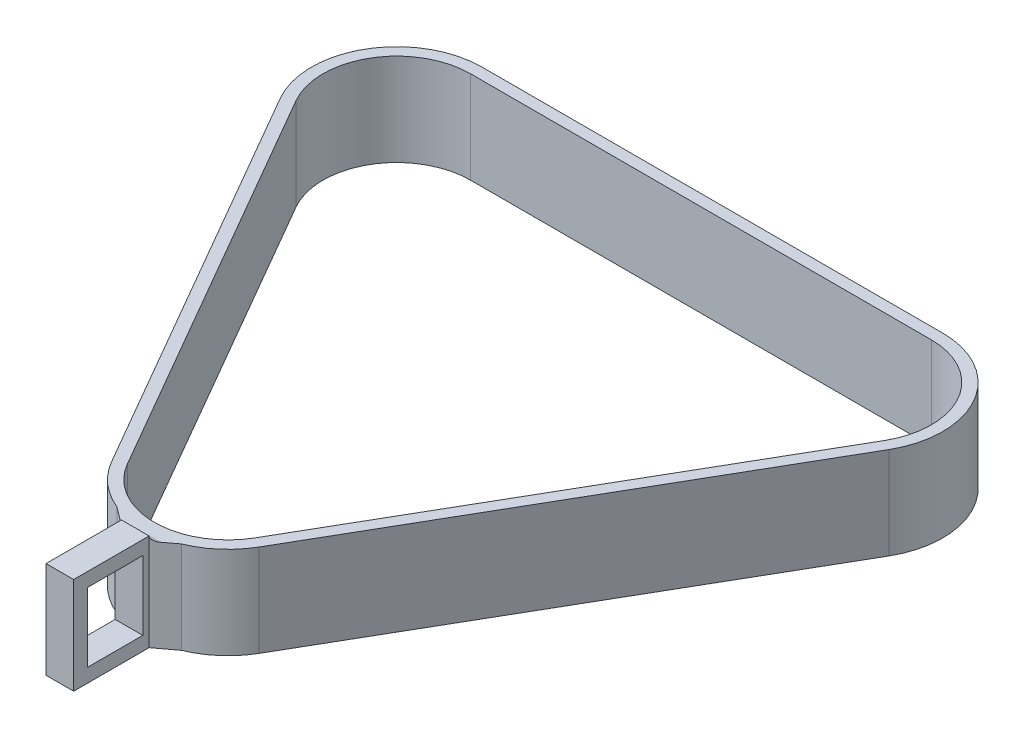
from build123d import *

# Parameters (mm, degrees)
BOSS_EXTRUDE1_DEPTH      = 20
BOSS_EXTRUDE2_DEPTH      = 3
BOSS_EXTRUDE2_DEPTH_BACK = 3
SKETCH2_W                = 18
SKETCH2_H                = 21
SKETCH2_W_2              = 12
SKETCH2_H_2              = 15
BOSS_EXTRUDE3_DEPTH      = 21
CUT_EXTRUDE1_DEPTH       = 30
CUT_EXTRUDE1_DEPTH_BACK  = 30
SKETCH4_W                = 3
SKETCH4_H                = 1
FILLET1_R                = 1


with BuildPart() as part:
    # Sketch1 → Boss-Extrude1 (new body)
    with BuildSketch(Plane(origin=(0, 0, 0), x_dir=(1, 0, 0), z_dir=(0, 1, 0))):
        with BuildLine():
            Line((31.500049634, -86.559686407), (-9.212862555, -16.042853971))
            ThreePointArc((-9.212862555, -16.042853971), (-13.066315501, -13.096617855), (-16.02146997, -9.25))
            Line((-16.02146997, -9.25), (33.97853003, -95.852540378))
            ThreePointArc((33.97853003, -95.852540378), (32.124838484, -91.369992609), (31.500049634, -86.559686407))
        make_face()
        with BuildLine():
            Line((36.143593539, -94.602540378), (31.500049634, -86.559686407))
            ThreePointArc((31.500049634, -86.559686407), (32.124838484, -91.369992609), (33.97853003, -95.852540378))
            ThreePointArc((33.97853003, -95.852540378), (50, -105.102540378), (66.02146997, -95.852540378))
            ThreePointArc((66.02146997, -95.852540378), (67.869627786, -91.390692713), (68.5, -86.602540378))
            ThreePointArc((68.5, -86.602540378), (68.499987591, -86.581113379), (68.499950366, -86.559686407))
            Line((68.499950366, -86.559686407), (63.856406461, -94.602540378))
            ThreePointArc((63.856406461, -94.602540378), (50, -102.602540378), (36.143593539, -94.602540378))
        make_face()
        with BuildLine():
            ThreePointArc((116.02146997, -9.25), (113.066315501, -13.096617855), (109.212862555, -16.042853971))
            Line((109.212862555, -16.042853971), (68.499950366, -86.559686407))
            ThreePointArc((68.499950366, -86.559686407), (68.499987591, -86.581113379), (68.5, -86.602540378))
            ThreePointArc((68.5, -86.602540378), (67.869627786, -91.390692713), (66.02146997, -95.852540378))
            Line((66.02146997, -95.852540378), (116.02146997, -9.25))
        make_face()
        with BuildLine():
            ThreePointArc((100, 18.5), (95.191153985, 17.864070085), (90.712912189, 16))
            Line((90.712912189, 16), (100, 16))
            ThreePointArc((100, 16), (111.313708499, 11.313708499), (116, 0))
            ThreePointArc((116, 0), (115.454813221, -4.141104722), (113.856406461, -8))
            Line((113.856406461, -8), (109.212862555, -16.042853971))
            ThreePointArc((109.212862555, -16.042853971), (113.066315501, -13.096617855), (116.02146997, -9.25))
            ThreePointArc((116.02146997, -9.25), (117.869627786, -4.788152334), (118.5, 0))
            ThreePointArc((118.5, 0), (113.081475452, 13.081475452), (100, 18.5))
        make_face()
        with BuildLine():
            ThreePointArc((0, 18.5), (4.808846015, 17.864070085), (9.287087811, 16))
            Line((9.287087811, 16), (90.712912189, 16))
            ThreePointArc((90.712912189, 16), (95.191153985, 17.864070085), (100, 18.5))
            Line((100, 18.5), (0, 18.5))
        make_face()
        with BuildLine():
            ThreePointArc((-13.856406461, -8), (-13.856406461, 8), (0, 16))
            Line((0, 16), (9.287087811, 16))
            ThreePointArc((9.287087811, 16), (4.808846015, 17.864070085), (0, 18.5))
            ThreePointArc((0, 18.5), (-16.02146997, 9.25), (-16.02146997, -9.25))
            ThreePointArc((-16.02146997, -9.25), (-13.066315501, -13.096617855), (-9.212862555, -16.042853971))
            Line((-9.212862555, -16.042853971), (-13.856406461, -8))
        make_face()
    extrude(amount=BOSS_EXTRUDE1_DEPTH)



with BuildPart() as body_2:
    # Sketch2 → Boss-Extrude2 (new, two sides: drawn at the far end of the back side and taken through both)
    with BuildSketch(Plane.ZY.offset(-50).offset(-BOSS_EXTRUDE2_DEPTH_BACK)):
        with Locations((114.102540378, 10.5)):
            Rectangle(SKETCH2_W, SKETCH2_H)
        with Locations((114.102540378, 10.5)):
            Rectangle(SKETCH2_W_2, SKETCH2_H_2, mode=Mode.SUBTRACT)
    extrude(amount=BOSS_EXTRUDE2_DEPTH + BOSS_EXTRUDE2_DEPTH_BACK)


with BuildPart() as part_1:
    add(part.part)

    add(body_2.part)  # Boss-Extrude3 merges body 2
    # Sketch3 → Boss-Extrude3 (add)
    with BuildSketch(Plane(origin=(0, 21, 0), x_dir=(1, 0, 0), z_dir=(0, 1, 0))):
        Polygon((43, -103.727084168), (47, -106.727084168), (47, -105.102540378), (53, -105.102540378), (53, -106.727084168), (57, -103.727084168), align=None)
    extrude(amount=-BOSS_EXTRUDE3_DEPTH)

    # Sketch4 → Cut-Extrude1 (cut, two sides: drawn at the far end of the back side and taken through both)
    with BuildSketch(Plane.ZY.offset(-50).offset(-CUT_EXTRUDE1_DEPTH_BACK)):
        with Locations((105.227084168, 20.5)):
            Rectangle(SKETCH4_W, SKETCH4_H)
    extrude(amount=CUT_EXTRUDE1_DEPTH + CUT_EXTRUDE1_DEPTH_BACK, mode=Mode.SUBTRACT)

    # Fillet1
    fillet1_edges = [part_1.edges().sort_by_distance(p)[0] for p in [
        (50, 20, 106.727084168),
    ]]
    fillet(fillet1_edges, radius=FILLET1_R - 0.0001)  # a hair under: the kernel refuses the full size


solid = part_1.part
